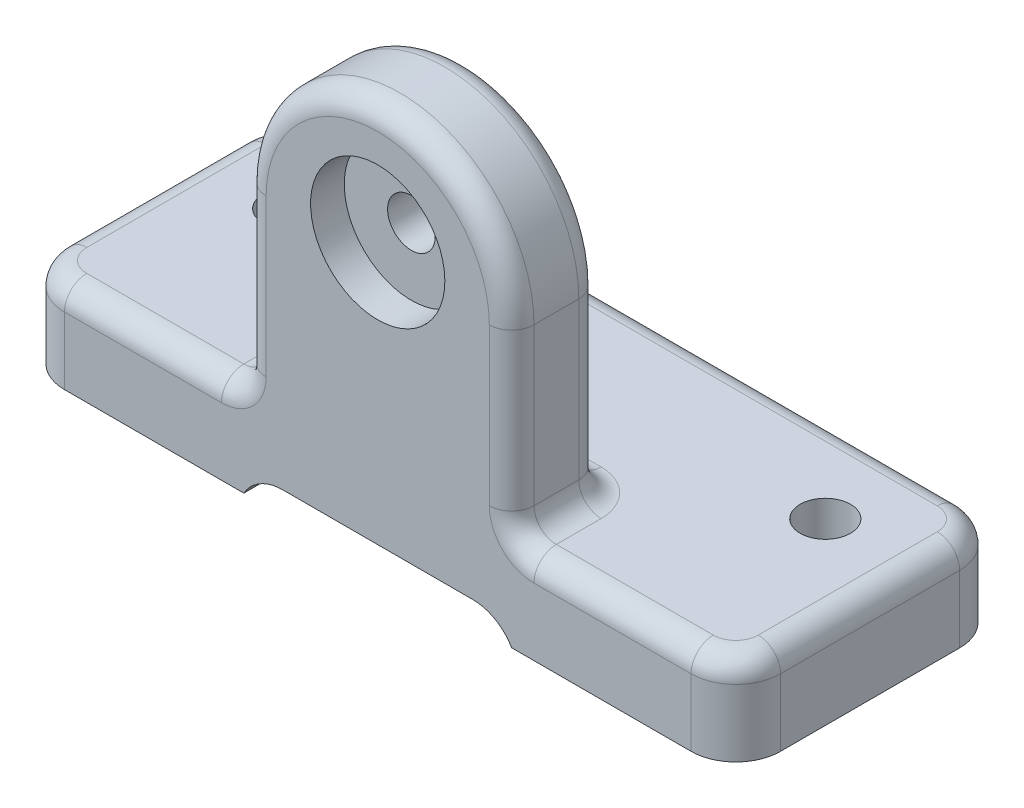
from build123d import *

# Parameters (mm, degrees)
SKETCH1_W                                = 101.6
SKETCH1_H                                = 38.1
BASEPLATE_DEPTH                          = 12.7
VERTBOSS_DEPTH                           = 12.7
F_9_32_0_28125_DIAMETER_HOLE1_D          = 7.14375
CBORE_FOR_1_4_HEX_HEAD_BOLT1_D           = 6.7564
CBORE_FOR_1_4_HEX_HEAD_BOLT1_CBORE_D     = 19.05
CBORE_FOR_1_4_HEX_HEAD_BOLT1_CBORE_DEPTH = 4.7752
SKETCH11_W                               = 38
SKETCH11_H                               = 3.17
BOTTOMSLOT_DEPTH                         = 123.615578129
FILLET1_R                                = 6.35
FILLET2_R                                = 3.17


with BuildPart() as part:
    # Sketch1 → BasePlate (new body)
    with BuildSketch(Plane(origin=(0, 0, 0), x_dir=(1, 0, 0), z_dir=(0, 1, 0))):
        with Locations((50.8, 19.05)):
            Rectangle(SKETCH1_W, SKETCH1_H)
    extrude(amount=BASEPLATE_DEPTH)

    # Sketch3 → VertBoss (add)
    with BuildSketch(Plane.XY):
        with BuildLine():
            Line((31.8, 0), (31.8, 38.1))
            ThreePointArc((31.8, 38.1), (50.8, 57.1), (69.8, 38.1))
            Line((69.8, 38.1), (69.8, 0))
            Line((69.8, 0), (31.8, 0))
        make_face()
    extrude(amount=-VERTBOSS_DEPTH)

    # 9/32 (0.28125) Diameter Hole1 (through all)
    with Locations(Plane(origin=(0, 12.7, 0), x_dir=(1, 0, 0), z_dir=(0, 1, 0))):
        with Locations((88.9, 25.4), (12.7, 25.4)):
            Hole(F_9_32_0_28125_DIAMETER_HOLE1_D / 2)

    # CBORE for 1/4 Hex Head Bolt1 (through all)
    with Locations(Plane.XY):
        with Locations((50.8, 40.318171365)):
            CounterBoreHole(CBORE_FOR_1_4_HEX_HEAD_BOLT1_D / 2, CBORE_FOR_1_4_HEX_HEAD_BOLT1_CBORE_D / 2, CBORE_FOR_1_4_HEX_HEAD_BOLT1_CBORE_DEPTH)

    # Sketch11 → BottomSlot (cut, through all)
    with BuildSketch(Plane.XY):
        with Locations((50.8, 1.585)):
            Rectangle(SKETCH11_W, SKETCH11_H)
    extrude(amount=-BOTTOMSLOT_DEPTH, mode=Mode.SUBTRACT)

    # Fillet1
    # the kernel refuses this fillet: 6.35 mm, written as the material it adds along each edge
    with BuildSketch(Plane(origin=(69.8, 3.17, 0), x_dir=(-1, 0, 0), z_dir=(0, 0, -1))) as fillet1_piece_1:
        with BuildLine():
            CenterArc((5.49637153, -6.35), FILLET1_R, 90, 59.947892244)
            Line((0, -3.17), (0, 0))
            Line((0, 0), (5.49637153, 0))
        make_face()
    extrude(amount=38.1)
    with BuildSketch(Plane(origin=(31.8, 3.17, 0), x_dir=(0, -1, 0), z_dir=(0, 0, -1))) as fillet1_piece_2:
        with BuildLine():
            CenterArc((6.35, -5.49637153), FILLET1_R, 120.052107756, 59.947892244)
            Line((0, -5.49637153), (0, 0))
            Line((0, 0), (3.17, 0))
        make_face()
    extrude(amount=38.1)
    # the kernel refuses this fillet: 6.35 mm, written as the material it takes off along each edge
    with BuildSketch(Plane(origin=(0, -15.875, -38.1), x_dir=(0, 0, 1), z_dir=(0, 1, 0)), Plane(origin=(0, -15.875, 0), x_dir=(1, 0, 0), z_dir=(0, 1, 0))) as fillet1_2_piece_1:
        with BuildLine():
            CenterArc((FILLET1_R, FILLET1_R), FILLET1_R, 180, 90)
            Line((0, FILLET1_R), (0, 0))
            Line((0, 0), (FILLET1_R, 0))
        make_face()
    extrude(amount=44.45, mode=Mode.SUBTRACT)
    with BuildSketch(Plane(origin=(101.6, -15.875, -38.1), x_dir=(0, 0, 1), z_dir=(0, 1, 0)), Plane(origin=(101.6, -15.875, 0), x_dir=(-1, 0, 0), z_dir=(0, 1, 0))) as fillet1_2_piece_2:
        with BuildLine():
            CenterArc((FILLET1_R, -FILLET1_R), FILLET1_R, 90, 90)
            Line((0, -FILLET1_R), (0, 0))
            Line((0, 0), (FILLET1_R, 0))
        make_face()
    extrude(amount=44.45, mode=Mode.SUBTRACT)

    # Fillet2
    fillet2_edges = [part.edges().sort_by_distance(p)[0] for p in [
        (82.525, 12.7, 0),
        (31.8, 25.4, -12.7),
        (69.8, 25.4, -12.7),
        (31.8, 25.4, 0),
        (69.8, 25.4, 0),
        (50.8, 57.1, 0),
        (31.8, 12.7, -6.35),
        (50.8, 57.1, -12.7),
        (69.8, 12.7, -6.35),
        (50.8, 12.7, -12.7),
        (0, 12.7, -19.05),
        (50.8, 12.7, -38.1),
        (19.075, 12.7, 0),
        (101.6, 12.7, -19.05),
        (99.740128061, 12.7, -1.859871939),
        (99.740128061, 12.7, -36.240128061),
        (1.859871939, 12.7, -1.859871939),
        (1.859871939, 12.7, -36.240128061),
    ]]
    fillet(fillet2_edges, radius=FILLET2_R)


solid = part.part
